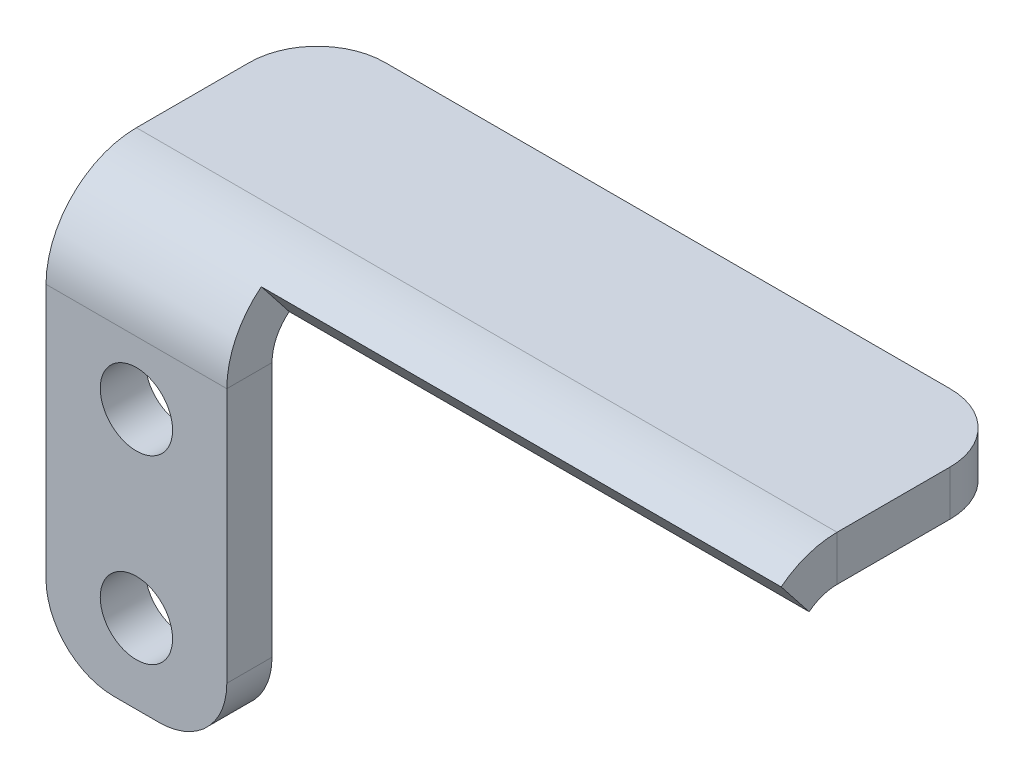
from build123d import *

# Parameters (mm, degrees)
SM_BASE_FLANGE_1_DEPTH = 2
SKETCH_8_R             = 1.6
CUT_EXTRUDE_1_DEPTH    = 10
FILLET_1_R             = 3
OTHER_START            = 6.58904
OTHER_1_OUTLINE_W      = 8
OTHER_1_OUTLINE_H      = 2
OTHER_1_DEPTH          = 15.41096
OTHER_START_2          = 5
OTHER_1_2_OUTLINE_R    = 1.6
OTHER_1_2_DEPTH        = 0.473479212
OTHER_START_3          = 6.529597681
OTHER_1_3_OUTLINE_W    = 8
OTHER_1_3_OUTLINE_H    = 2
OTHER_1_3_DEPTH        = 0.059442319
OTHER_START_4          = 3
OTHER_1_4_OUTLINE_R    = 1.6
OTHER_1_4_DEPTH        = 4
OTHER_1_5_OUTLINE_W    = 23
OTHER_1_5_OUTLINE_H    = 2
OTHER_1_5_DEPTH        = 0.46188997
OTHER_START_5          = -15.5
OTHER_1_6_DEPTH        = 31
OTHER_START_6          = -7.5
OTHER_1_7_DEPTH        = 23
OTHER_1_8_DEPTH        = 23


with BuildPart() as part:
    # 基体-法兰1: sheet metal written as solids
    # Sketch 1 → 基体-法兰1 (new body)
    with BuildSketch(Plane(origin=(0, 0, 0), x_dir=(1, 0, 0), z_dir=(0, 1, 0))):
        Polygon((-7.5, -5), (15.5, -5), (15.5, 5), (-15.5, 5), (-15.5, -5), (-15.5, -22), (-7.5, -22), align=None)
    extrude(amount=-SM_BASE_FLANGE_1_DEPTH)

    # 草图8 → 切除-拉伸1 (cut)
    with BuildSketch(Plane.XZ.offset(2)):
        with Locations(Location((-11.5, 18.5, 0), (0, 0, 270))):
            Circle(SKETCH_8_R)
        with Locations(Location((-11.5, 10.5, 0), (0, 0, 270))):
            Circle(SKETCH_8_R)
    extrude(amount=-CUT_EXTRUDE_1_DEPTH, mode=Mode.SUBTRACT)

    # 圆角1
    fillet_1_edges = [part.edges().sort_by_distance(p)[0] for p in [
        (15.5, -1, -5),
        (-15.5, -1, -5),
        (-15.5, -1, 22),
        (-7.5, -1, 22),
    ]]
    fillet(fillet_1_edges, radius=FILLET_1_R)

    # Other 1: read off the stored shape, not the designer's step
    # Other 1 outline → Other 1 (cut)
    with BuildSketch(Plane.XY.offset(OTHER_START)):
        with Locations((-11.5, -1)):
            Rectangle(OTHER_1_OUTLINE_W, OTHER_1_OUTLINE_H)
    extrude(amount=OTHER_1_DEPTH, mode=Mode.SUBTRACT)

    # Other 1 2 outline → Other 1 2 (add)
    with BuildSketch(Plane.XY.offset(OTHER_START_2)):
        with BuildLine():
            Line((-7.5, -15.28761102), (-7.5, -2))
            Line((-7.5, -2), (-15.5, -2))
            Line((-15.5, -2), (-15.5, -15.28761102))
            ThreePointArc((-15.5, -15.28761102), (-14.621320344, -17.408931363), (-12.5, -18.28761102))
            Line((-12.5, -18.28761102), (-10.5, -18.28761102))
            ThreePointArc((-10.5, -18.28761102), (-8.378679656, -17.408931364), (-7.5, -15.28761102))
        make_face()
        with Locations((-11.5, -14.78761102)):
            Circle(OTHER_1_2_OUTLINE_R, mode=Mode.SUBTRACT)
        with Locations((-11.5, -6.78761102)):
            Circle(OTHER_1_2_OUTLINE_R, mode=Mode.SUBTRACT)
    extrude(amount=OTHER_1_2_DEPTH)

    # Other 1 3 outline → Other 1 3 (cut)
    with BuildSketch(Plane.XY.offset(OTHER_START_3)):
        with Locations((-11.5, -1)):
            Rectangle(OTHER_1_3_OUTLINE_W, OTHER_1_3_OUTLINE_H)
    extrude(amount=OTHER_1_3_DEPTH, mode=Mode.SUBTRACT)

    # Other 1 4 outline → Other 1 4 (add)
    with BuildSketch(Plane.XY.offset(OTHER_START_4)):
        with BuildLine():
            Line((-7.5, -15.28761102), (-7.5, -2))
            Line((-7.5, -2), (-15.5, -2))
            Line((-15.5, -2), (-15.5, -15.28761102))
            ThreePointArc((-15.5, -15.28761102), (-14.621320344, -17.408931363), (-12.5, -18.28761102))
            Line((-12.5, -18.28761102), (-10.5, -18.28761102))
            ThreePointArc((-10.5, -18.28761102), (-8.378679656, -17.408931364), (-7.5, -15.28761102))
        make_face()
        with Locations((-11.5, -14.78761102)):
            Circle(OTHER_1_4_OUTLINE_R, mode=Mode.SUBTRACT)
        with Locations((-11.5, -6.78761102)):
            Circle(OTHER_1_4_OUTLINE_R, mode=Mode.SUBTRACT)
    extrude(amount=OTHER_1_4_DEPTH)

    # Other 1 5 outline → Other 1 5 (add)
    with BuildSketch(Plane.XY.offset(OTHER_START_2)):
        with Locations((4, -1)):
            Rectangle(OTHER_1_5_OUTLINE_W, OTHER_1_5_OUTLINE_H)
    extrude(amount=OTHER_1_5_DEPTH)

    # Other 1 6 outline → Other 1 6 (cut)
    with BuildSketch(Plane.YZ.offset(OTHER_START_5)):
        with BuildLine():
            ThreePointArc((-2, 3), (-2.585786438, 4.414213562), (-4, 5))
            Line((-4, 5), (-18.28761102, 5))
            Line((-18.28761102, 5), (-18.28761102, 3))
            Line((-18.28761102, 3), (-2, 3))
        make_face()
        with BuildLine():
            Line((-2, 7), (-4, 7))
            ThreePointArc((-4, 7), (-1.171572875, 5.828427125), (0, 3))
            Line((0, 3), (0, 6.529597681))
            Line((0, 6.529597681), (-2, 6.529597681))
            Line((-2, 6.529597681), (-2, 7))
        make_face()
    extrude(amount=OTHER_1_6_DEPTH, mode=Mode.SUBTRACT)

    # Other 1 7 outline → Other 1 7 (cut)
    with BuildSketch(Plane.YZ.offset(OTHER_START_6)):
        Polygon((-2, 5.46188997), (-2, 4.573685779), (-0.871179745, 5.46188997), align=None)
    extrude(amount=OTHER_1_7_DEPTH, mode=Mode.SUBTRACT)

    # Other 1 8 outline → Other 1 8 (add)
    with BuildSketch(Plane.YZ.offset(OTHER_START_6)):
        with BuildLine():
            Line((-2, 4.573685779), (-2.428225479, 4.236739606))
            ThreePointArc((-2.428225479, 4.236739606), (-2.110086108, 3.654389393), (-2, 3))
            Line((-2, 3), (-2, 4.573685779))
        make_face()
        with BuildLine():
            Line((-0.856450957, 5.473479212), (-0.871179745, 5.46188997))
            Line((-0.871179745, 5.46188997), (-0.847366533, 5.46188997))
            ThreePointArc((-0.847366533, 5.46188997), (-0.851903412, 5.467688772), (-0.856450957, 5.473479212))
        make_face()
    extrude(amount=OTHER_1_8_DEPTH)


solid = part.part
